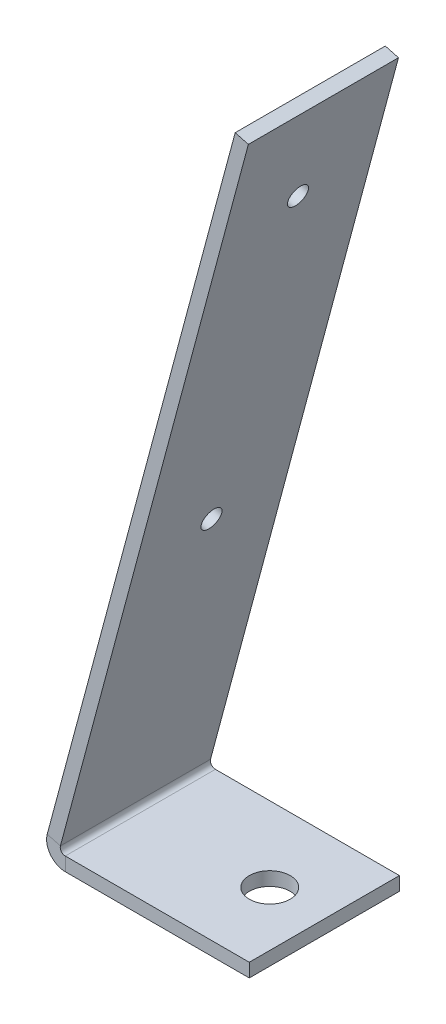
from build123d import *

# Parameters (mm, degrees)
SKETCH2_W                 = 30
SKETCH2_H                 = 22
BASE_FLANGE1_DEPTH        = 2
EDGE_FLANGE1_START        = -11
EDGE_FLANGE1_DEPTH        = 22
EDGE_FLANGE1_2_DEPTH      = 22
F_6_0MM_DOWEL_HOLE1_D     = 6
F_6_0MM_DOWEL_HOLE1_DEPTH = 2
F_3_0MM_DOWEL_HOLE1_D     = 3


# Read off the part's stored shape, not the designer's step: Edge-Flange1
# Sheet-metal steps are written as plain solids
with BuildPart() as part:
    # Sketch2 → Base-Flange1 (new body)
    with BuildSketch(Plane(origin=(0, 0, 0), x_dir=(1, 0, 0), z_dir=(0, 1, 0))):
        with Locations((-15, 0)):
            Rectangle(SKETCH2_W, SKETCH2_H)
    extrude(amount=-BASE_FLANGE1_DEPTH)

    # Edge-Flange1 outline → Edge-Flange1 (cut)
    with BuildSketch(Plane.XY.offset(EDGE_FLANGE1_START)):
        with BuildLine():
            ThreePointArc((-26.96949183, -2), (-28.62375904, -1.443395312), (-29.605094228, 0))
            Line((-29.605094228, 0), (-30, 0))
            Line((-30, 0), (-30, -2))
            Line((-30, -2), (-26.96949183, -2))
        make_face()
    extrude(amount=EDGE_FLANGE1_DEPTH, mode=Mode.SUBTRACT)

    # Edge-Flange1 2 outline → Edge-Flange1 2 (add)
    with BuildSketch(Plane.XY.offset(EDGE_FLANGE1_START)):
        with BuildLine():
            Line((-2.065803424, 104.251840892), (-29.612844446, 1.444884199))
            ThreePointArc((-29.612844446, 1.444884199), (-29.706052463, 0.721921355), (-29.605094228, 0))
            Line((-29.605094228, 0), (-26.96949183, 0))
            ThreePointArc((-26.96949183, 0), (-27.5538759, 0.288186332), (-27.680992793, 0.927246109))
            Line((-27.680992793, 0.927246109), (-0.133951771, 103.734202802))
            Line((-0.133951771, 103.734202802), (-2.065803424, 104.251840892))
        make_face()
    extrude(amount=EDGE_FLANGE1_2_DEPTH)

    # Ø6.0mm Dowel Hole1
    with Locations(Plane(origin=(0, 0, 0), x_dir=(1, 0, 0), z_dir=(0, 1, 0))):
        with Locations((-8, 0)):
            Hole(F_6_0MM_DOWEL_HOLE1_D / 2, depth=F_6_0MM_DOWEL_HOLE1_DEPTH)

    # Ø3.0mm Dowel Hole1 (through all)
    with Locations(Plane(origin=(-27.990381057, 7.5, 0), x_dir=(0, 0, 1), z_dir=(-0.9659258262890691, 0.258819045102518, 0))):
        with Locations((0, 85.764876286), (0, 36.764876286)):
            Hole(F_3_0MM_DOWEL_HOLE1_D / 2)


solid = part.part
